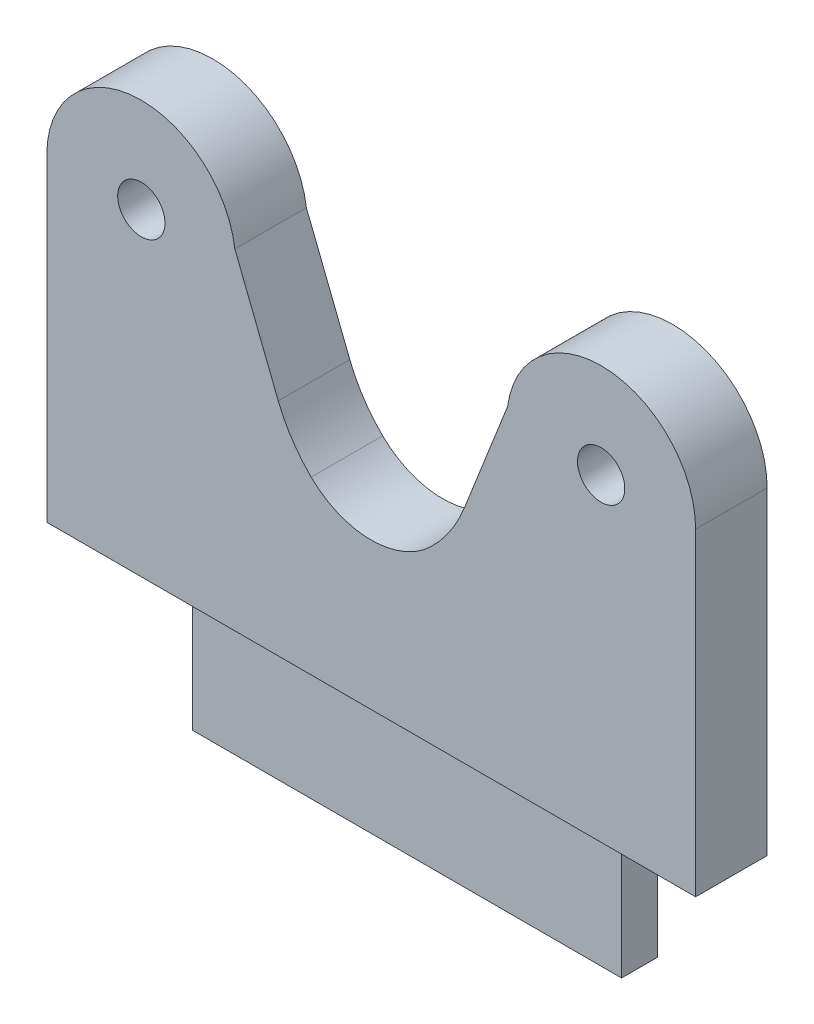
from build123d import *

# Parameters (mm, degrees)
BOSS_EXTRU_1_DEPTH             = 3.175
ESQUISSE3_R                    = 2.1
ENL_V_MAT_EXTRU_1_DEPTH        = 48.041658028
ESQUISSE4_W                    = 38.1
ESQUISSE4_H                    = 12.7
ENL_V_MAT_EXTRU_2_DEPTH        = 3.175
CONG_1_R                       = 12.7
CONG_4_R                       = 7.62
CONG_5_R                       = 15.24
BOSS_EXTRU_4_REACH             = 48.719
BOSS_EXTRU_4_DIRECTION_2_REACH = 48.719
CONG_6_R                       = 2.54
BOSS_EXTRU_5_REACH             = 49.042


with BuildPart() as part:
    # Esquisse2 → Boss.-Extru.1 (new, symmetric)
    with BuildSketch(Plane.XY):
        with BuildLine():
            Line((19.05, 0), (28.29484395, 25.4))
            ThreePointArc((28.29484395, 25.4), (22.40844386, 36.409135129), (12.107464983, 29.356433767))
            Line((12.107464983, 29.356433767), (5.08, 11.576433767))
            Line((5.08, 11.576433767), (-5.08, 11.576433767))
            Line((-5.08, 11.576433767), (-12.107464983, 29.356433767))
            ThreePointArc((-12.107464983, 29.356433767), (-22.40844386, 36.409135129), (-28.29484395, 25.4))
            Line((-28.29484395, 25.4), (-19.05, 0))
            Line((-19.05, 0), (-19.05, -12.7))
            Line((-19.05, -12.7), (19.05, -12.7))
            Line((19.05, -12.7), (19.05, 0))
        make_face()
    extrude(amount=BOSS_EXTRU_1_DEPTH, both=True)

    # Esquisse3 → Enlèv. mat.-Extru.1 (cut, through all)
    with BuildSketch(Plane.XY.offset(3.175)):
        with Locations((-20.410216204, 28.244491788)):
            Circle(ESQUISSE3_R)
    enl_v_mat_extru_1 = extrude(amount=-ENL_V_MAT_EXTRU_1_DEPTH, mode=Mode.SUBTRACT)

    # Symétrie1: Enlèv. mat.-Extru.1 across plane
    add(enl_v_mat_extru_1.mirror(Plane(origin=(0, 0, 0), x_dir=(0, 0, 1), z_dir=(1, 0, 0))), mode=Mode.SUBTRACT)

    # Esquisse4 → Enlèv. mat.-Extru.2 (cut)
    with BuildSketch(Plane.XY.offset(3.175)):
        with Locations((0, -6.35)):
            Rectangle(ESQUISSE4_W, ESQUISSE4_H)
    extrude(amount=-ENL_V_MAT_EXTRU_2_DEPTH, mode=Mode.SUBTRACT)

    # Congé1
    # the kernel refuses this fillet: 12.7 mm, written as the material it adds along each edge
    with BuildSketch(Plane(origin=(5.08, 11.576433767, -3.175), x_dir=(0.3675757751944704, 0.9299935749725285, 0), z_dir=(0, 0, 1)), Plane(origin=(-5.08, 11.576433767, -3.175), x_dir=(1, 0, 0), z_dir=(0, 0, 1))) as cong_1_piece_1:
        with BuildLine():
            CenterArc((CONG_1_R * 0.68003074626, CONG_1_R), CONG_1_R, 201.566186537, 68.433813463)
            Line((-CONG_1_R * 0.249962828713, CONG_1_R * 0.632424224806), (0, 0))
            Line((0, 0), (CONG_1_R * 0.68003074626, 0))
        make_face()
    extrude(amount=6.35)

    # Congé4
    cong_4_edges = [part.edges().sort_by_distance(p)[0] for p in [
        (0, 12.084547663, 0),
    ]]
    fillet(cong_4_edges, radius=CONG_4_R)

    # Congé5
    cong_5_edges = [part.edges().sort_by_distance(p)[0] for p in [
        (-19.05, 0, -1.5875),
        (19.05, 0, -1.5875),
    ]]
    fillet(cong_5_edges, radius=CONG_5_R)

    # Boss.-Extru.4: up to this face of the body (flat: up to its plane)
    boss_extru_4_end = Plane(part.part.faces().sort_by_distance((9.3e-08, 10.23403755, -3.175))[0])
    # Esquisse6 → Boss.-Extru.4 (add, up to the picked face)
    with BuildSketch(Plane.XY, mode=Mode.PRIVATE) as boss_extru_4_sk1:
        with BuildLine():
            Line((28.800340403, 28.266812841), (28.800340403, 0))
            Line((28.800340403, 0), (19.288785664, 0))
            ThreePointArc((19.288785664, 0), (19.57466996, 1.27720134), (19.969084459, 2.525163798))
            Line((19.969084459, 2.525163798), (28.29484395, 25.4))
            ThreePointArc((28.29484395, 25.4), (28.672998989, 26.811293816), (28.800340403, 28.266812841))
        make_face()
    boss_extru_4_tool1 = split(extrude(boss_extru_4_sk1.sketch, amount=-BOSS_EXTRU_4_REACH, mode=Mode.PRIVATE), bisect_by=boss_extru_4_end, keep=Keep.BOTH, mode=Mode.PRIVATE)
    boss_extru_4 = boss_extru_4_tool1.solids().sort_by(Axis((25.562927, 8.959806, 0), (0, 0, -1)))[0]
    add(boss_extru_4)

    # Boss.-Extru.4 direction 2: up to this face of the body (flat: up to its plane)
    boss_extru_4_direction_2_end = Plane(part.part.faces().sort_by_distance((7.594682873, 16.877070462, 3.175))[0])
    # Esquisse6 → Boss.-Extru.4 direction 2 (add, up to the picked face)
    with BuildSketch(Plane.XY, mode=Mode.PRIVATE) as boss_extru_4_direction_2_sk1:
        with BuildLine():
            Line((28.800340403, 28.266812841), (28.800340403, 0))
            Line((28.800340403, 0), (19.288785664, 0))
            ThreePointArc((19.288785664, 0), (19.57466996, 1.27720134), (19.969084459, 2.525163798))
            Line((19.969084459, 2.525163798), (28.29484395, 25.4))
            ThreePointArc((28.29484395, 25.4), (28.672998989, 26.811293816), (28.800340403, 28.266812841))
        make_face()
    boss_extru_4_direction_2_tool1 = split(extrude(boss_extru_4_direction_2_sk1.sketch, amount=BOSS_EXTRU_4_DIRECTION_2_REACH, mode=Mode.PRIVATE), bisect_by=boss_extru_4_direction_2_end, keep=Keep.BOTH, mode=Mode.PRIVATE)
    boss_extru_4_direction_2 = boss_extru_4_direction_2_tool1.solids().sort_by(Axis((25.562927, 8.959806, 0), (0, 0, 1)))[0]
    add(boss_extru_4_direction_2)

    # Symétrie3: Boss.-Extru.4, Boss.-Extru.4 direction 2 across plane
    add(boss_extru_4.mirror(Plane(origin=(0, 0, 0), x_dir=(0, 0, 1), z_dir=(1, 0, 0))))
    add(boss_extru_4_direction_2.mirror(Plane(origin=(0, 0, 0), x_dir=(0, 0, 1), z_dir=(1, 0, 0))))

    # Congé6
    cong_6_edges = [part.edges().sort_by_distance(p)[0] for p in [
        (-19.288785664, 0, -1.5875),
        (19.288785664, 0, -1.5875),
    ]]
    fillet(cong_6_edges, radius=CONG_6_R)

    # Esquisse7 → Boss.-Extru.5 (add, up to next)
    with BuildSketch(Plane.XY.offset(3.175), mode=Mode.PRIVATE) as boss_extru_5_sk1:
        with BuildLine():
            Line((-19.288785664, 0), (-19.05, 0))
            Line((-19.05, 0), (-19.969084459, 2.525163798))
            ThreePointArc((-19.969084459, 2.525163798), (-19.57466996, 1.27720134), (-19.288785664, 0))
        make_face()
    boss_extru_5_tool1 = extrude(boss_extru_5_sk1.sketch, amount=-BOSS_EXTRU_5_REACH, mode=Mode.PRIVATE) - part.part
    boss_extru_5 = boss_extru_5_tool1.solids().sort_by_distance((-19.353449, 0.636158, 3.175))[0]
    add(boss_extru_5)

    # Symétrie4: Boss.-Extru.5 across plane
    add(boss_extru_5.mirror(Plane(origin=(0, 0, 0), x_dir=(0, 0, 1), z_dir=(1, 0, 0))))


solid = part.part
